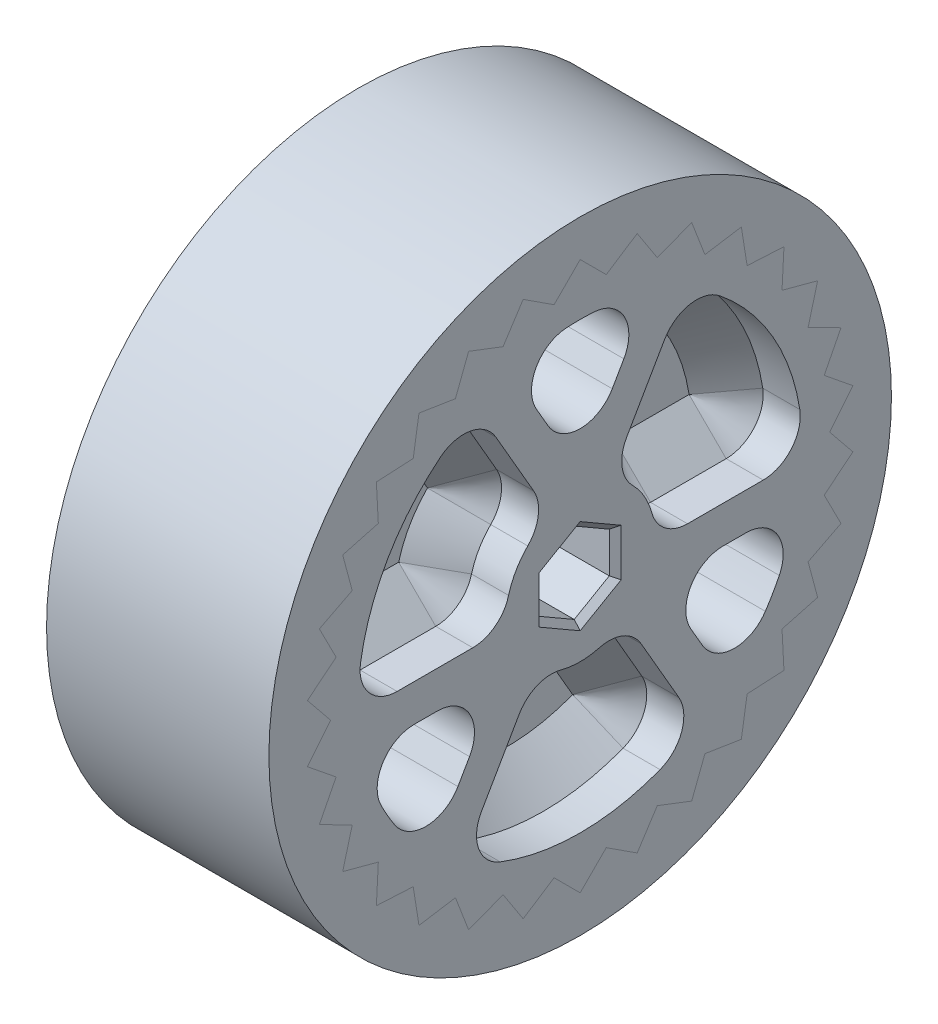
from build123d import *
from build123d.topology import SkipClean

# Parameters (mm, degrees)
SKETCH1_R               = 25.4
BOSS_EXTRUDE2_DEPTH     = 3.175
SKETCH3_R               = 6.35
BOSS_EXTRUDE3_DEPTH     = 9.525
BOSS_EXTRUDE4_REACH     = 42.66
CIRPATTERN5_COUNT       = 3
FILLET1_R               = 3.175
FILLET2_R               = 3.175
CUT_EXTRUDE2_DEPTH      = 41.65983890769865
CUT_EXTRUDE2_DEPTH_BACK = 41.65983890769865
CHAMFER1_SIZE           = 3.175
SHAFTCHAMFER_SIZE       = 0.508
SKETCH8_R               = 26.669999999999998
SKETCH8_R_2             = 12.7
BOSS_EXTRUDE5_DEPTH     = 19.05
CUT_EXTRUDE3_DEPTH      = 43.25494413450336
CIRPATTERN9_COUNT       = 30
CUT_EXTRUDE4_DEPTH      = 43.25494408941988
CUT_EXTRUDE4_DEPTH_BACK = 43.25494408941988
SKETCH10_R              = 26.669999999999998


# Some blends are built 0.0001 mm under size
with BuildPart() as part:
    # Sketch1 → Boss-Extrude2 (new, symmetric)
    with BuildSketch(Plane(origin=(0, 0, 0), x_dir=(0, 0, -1), z_dir=(1, 0, 0))):
        Circle(SKETCH1_R)
    extrude(amount=BOSS_EXTRUDE2_DEPTH, both=True)

    # Sketch3 → Boss-Extrude3 (add, symmetric)
    with BuildSketch(Plane(origin=(0, 0, 0), x_dir=(0, 0, -1), z_dir=(1, 0, 0))):
        Circle(SKETCH3_R)
    extrude(amount=BOSS_EXTRUDE3_DEPTH, both=True)

    # Boss-Extrude4: up to this face of the body (flat: up to its plane)
    boss_extrude4_end = Plane(part.part.faces().sort_by_distance((-9.525, 0, 0))[0])
    # Sketch5 → Boss-Extrude4 (add, up to the picked face)
    with BuildSketch(Plane(origin=(9.525, 0, 0), x_dir=(0, 0, -1), z_dir=(1, 0, 0)), mode=Mode.PRIVATE) as boss_extrude4_sk1:
        with BuildLine():
            Line((-2.54, 5.819871132593916), (-8.903299782514784, 16.84142965970147))
            ThreePointArc((-8.903299782514784, 16.84142965970147), (-14.505014042261495, 12.349375192040972), (-18.045993050535788, 6.102838259368668))
            Line((-18.045993050535788, 6.102838259368668), (-23.94116621038132, 8.484135812614952))
            ThreePointArc((-23.94116621038132, 8.484135812614952), (-19.29769987032471, 16.515410370767952), (-12.079956061561274, 22.343559733192674))
            ThreePointArc((-12.079956061561274, 22.343559733192674), (1.56e-15, 25.400000000000002), (12.079956061561273, 22.343559733192674))
            ThreePointArc((12.079956061561273, 22.343559733192674), (19.227340571827934, 16.59727009284778), (23.868192567962097, 8.687311640471918))
            Line((23.868192567962097, 8.687311640471918), (17.901144425971573, 6.51548373035394))
            ThreePointArc((17.901144425971573, 6.51548373035394), (14.362306470947372, 12.515057044799413), (8.903299782514784, 16.84142965970147))
            Line((8.903299782514784, 16.84142965970147), (2.54, 5.819871132593916))
            Line((2.54, 5.819871132593916), (-2.54, 5.819871132593916))
        make_face()
        with BuildLine():
            Line((-5.960089873328659, 18.09364055965093), (0, 7.770462081368971))
            Line((0, 7.770462081368971), (5.960089873328663, 18.093640559650932))
            ThreePointArc((5.960089873328663, 18.093640559650932), (1.17e-15, 19.050000000000004), (-5.960089873328659, 18.09364055965093))
        make_face(mode=Mode.SUBTRACT)
    boss_extrude4_tool1 = split(extrude(boss_extrude4_sk1.sketch, amount=-BOSS_EXTRUDE4_REACH, mode=Mode.PRIVATE), bisect_by=boss_extrude4_end, keep=Keep.BOTH, mode=Mode.PRIVATE)
    boss_extrude4 = boss_extrude4_tool1.solids().sort_by(Axis((9.525, 11.588968, -5.274231), (-1, 0, 0)))[0]
    add(boss_extrude4)

    # CirPattern5: Boss-Extrude4 ×3 about axis
    with SkipClean():  # the faces are left unmerged after this step: merging them gives an invalid solid
        cirpattern5_axis = Axis((0, -4e-17, 2e-17), (1, 0, 0))
        for i in range(1, CIRPATTERN5_COUNT):
            add(boss_extrude4.rotate(cirpattern5_axis, i * 360 / CIRPATTERN5_COUNT))

    # Fillet1
    # the kernel refuses this fillet: 3.175 mm, written as the material it adds along each edge
    with BuildSketch(Plane(origin=(9.525, -0.7102310406844579, 19.036755812607577), x_dir=(0, -2.38e-15, -1), z_dir=(-1, 0, 0))) as fillet1_piece_1_section:
        with BuildLine():
            CenterArc((3.3542643339810048, -3.175), FILLET1_R, 89.99999999999996, 98.93193584049112)
            ThreePointArc((0.21776603825569132, -3.6679537918630993), (0.02024089159850024, -1.8392395698991024), (0, 0))
            Line((0, 0), (3.354264333981007, 0))
        make_face()
    fillet1_piece_1 = extrude(amount=15.536031197782203, mode=Mode.PRIVATE)
    fillet1_piece_1 = split(fillet1_piece_1, bisect_by=Plane(origin=(-3.175, 0.11590119429228372, 18.292392376393625), z_dir=(1, 0, 0)), keep=Keep.TOP, mode=Mode.PRIVATE)
    add(fillet1_piece_1)
    with BuildSketch(Plane(origin=(9.525, -0.7102310406844823, 6.310156247578044), x_dir=(0, 1.38e-15, 1), z_dir=(-1, 0, 0))) as fillet1_piece_2_section:
        with BuildLine():
            CenterArc((2.8904165050931043, 3.175), FILLET1_R, 194.99699559216134, 75.00300440783866)
            ThreePointArc((-0.17644107913061133, 2.35341034689483), (0.02207235062195231, 1.1849741081832343), (0, 0))
            Line((0, 0), (2.890416505093105, 0))
        make_face()
    fillet1_piece_2 = extrude(amount=13.576041262732764, mode=Mode.PRIVATE)
    fillet1_piece_2 = split(fillet1_piece_2, bisect_by=Plane(origin=(-3.175, -0.1820541246361337, 6.989140739238721), z_dir=(1, 0, 0)), keep=Keep.TOP, mode=Mode.PRIVATE)
    add(fillet1_piece_2)
    with BuildSketch(Plane(origin=(9.525, -5.109640091909432, 3.7701562475780452), x_dir=(0, -0.43385429013787896, -0.900983049190692), z_dir=(-1, 0, 0))) as fillet1_piece_3_section:
        with BuildLine():
            CenterArc((2.950018992331989, 3.1196987863887142), FILLET1_R, 184.2875870351815, 75.00300440783866)
            Line((-0.21609530676800845, 2.8823272526393455), (0, 0))
            ThreePointArc((0, 0), (1.1800075969327894, 0.11060242722256897), (2.3600151938655904, -5e-17))
        make_face()
    fillet1_piece_3 = extrude(amount=13.576041262732764, mode=Mode.PRIVATE)
    fillet1_piece_3 = split(fillet1_piece_3, bisect_by=Plane(origin=(-3.175, -5.961746368487418, 3.652233866417988), z_dir=(1, 0, 0)), keep=Keep.TOP, mode=Mode.PRIVATE)
    add(fillet1_piece_3)
    with BuildSketch(Plane(origin=(9.525, -16.131198619017, 10.133456030092796), x_dir=(0, -0.447795663680597, -0.8941359200864563), z_dir=(-1, 0, 0))) as fillet1_piece_4_section:
        with BuildLine():
            CenterArc((3.368211439186808, -3.1602002979476134), FILLET1_R, 84.46572042198898, 98.93193584049106)
            Line((0.1987922856852959, -3.3483683861500437), (0, 0))
            ThreePointArc((0, 0), (1.837206239556442, 0.08879821231431297), (3.6744124791128843, -5e-17))
        make_face()
    fillet1_piece_4 = extrude(amount=15.536031197782211, mode=Mode.PRIVATE)
    fillet1_piece_4 = split(fillet1_piece_4, bisect_by=Plane(origin=(-3.175, -15.899627091095816, 9.045822809610737), z_dir=(1, 0, 0)), keep=Keep.TOP, mode=Mode.PRIVATE)
    add(fillet1_piece_4)
    with BuildSketch(Plane(origin=(9.525, -3.885231040684464, 18.64959730826653), x_dir=(0, -0.9450213382412374, -0.3270086700207519), z_dir=(-1, 0, 0))) as fillet1_piece_5_section:
        with BuildLine():
            CenterArc((4.449415253717177, -3.1491286068759607), FILLET1_R, 82.68067523582678, 116.40663891770015)
            Line((1.4489725048012276, -4.187381134191788), (0, 0))
            ThreePointArc((0, 0), (2.4269537747548258, 0.1552283587442323), (4.8539075495096515, 2.1e-16))
        make_face()
    fillet1_piece_5 = extrude(amount=18.48476887377413, mode=Mode.PRIVATE)
    fillet1_piece_5 = split(fillet1_piece_5, bisect_by=Plane(origin=(-3.175, -4.983509998192897, 17.329741100134743), z_dir=(1, 0, 0)), keep=Keep.TOP, mode=Mode.PRIVATE)
    add(fillet1_piece_5)
    with BuildSketch(Plane(origin=(9.525, -14.208409518966457, 12.689507434937868), x_dir=(0, 0.8660254037844392, -0.4999999999999991), z_dir=(-1, 0, 0))) as fillet1_piece_6_section:
        with BuildLine():
            CenterArc((4.43099109485172, -3.1750000000000007), FILLET1_R, 89.99999999999999, 116.4066389177014)
            ThreePointArc((1.5872698521687754, -4.587046208136892), (0.6469408147709594, -2.34428412321089), (0, 0))
            Line((0, 0), (4.430991094851721, -3e-17))
        make_face()
    fillet1_piece_6 = extrude(amount=18.48476887377416, mode=Mode.PRIVATE)
    fillet1_piece_6 = split(fillet1_piece_6, bisect_by=Plane(origin=(-3.175, -12.51624103462754, 12.98071680851615), z_dir=(1, 0, 0)), keep=Keep.TOP, mode=Mode.PRIVATE)
    add(fillet1_piece_6)
    with BuildSketch(Plane(origin=(9.525, -3.885231040684484, 6.7294175616092335), x_dir=(0, -0.8660254037844392, 0.4999999999999991), z_dir=(-1, 0, 0))) as fillet1_piece_7_section:
        with BuildLine():
            CenterArc((FILLET1_R * 1.73205080757, FILLET1_R), FILLET1_R, 150.00000000000023, 119.99999999999972)
            Line((FILLET1_R * 0.866025403784, FILLET1_R * 1.5), (0, 0))
            Line((0, 0), (FILLET1_R * 1.73205080757, 9e-17))
        make_face()
    fillet1_piece_7 = extrude(amount=20.098153285077924, mode=Mode.PRIVATE)
    fillet1_piece_7 = split(fillet1_piece_7, bisect_by=Plane(origin=(-3.175, -5.052771317428874, 8.751656640813545), z_dir=(1, 0, 0)), keep=Keep.TOP, mode=Mode.PRIVATE)
    add(fillet1_piece_7)
    with BuildSketch(Plane(origin=(9.525, -16.131198619017013, -10.133456030092784), x_dir=(0, -0.44779566368059587, 0.8941359200864568), z_dir=(-1, 0, 0))) as fillet1_piece_8_section:
        with BuildLine():
            CenterArc((3.3682114391868097, 3.1602002979476143), FILLET1_R, 176.60234373751985, 98.93193584049118)
            Line((0.19879228568529747, 3.348368386150048), (0, 0))
            ThreePointArc((0, 0), (1.8372062395564435, -0.0887982123143144), (3.674412479112885, -1.9e-16))
        make_face()
    fillet1_piece_8 = extrude(amount=15.536031197782213, mode=Mode.PRIVATE)
    fillet1_piece_8 = split(fillet1_piece_8, bisect_by=Plane(origin=(-3.175, -15.899627091095827, -9.045822809610733), z_dir=(1, 0, 0)), keep=Keep.TOP, mode=Mode.PRIVATE)
    add(fillet1_piece_8)
    with BuildSketch(Plane(origin=(9.525, -5.1096400919094345, -3.7701562475780417), x_dir=(0, -0.8660254037844396, -0.4999999999999982), z_dir=(-1, 0, 0))) as fillet1_piece_9_section:
        with BuildLine():
            CenterArc((2.8904165050931026, 3.175), FILLET1_R, 194.9969955921613, 75.00300440783872)
            ThreePointArc((-0.17644107913061302, 2.3534103468948313), (0.02207235062195104, 1.184974108183239), (0, 0))
            Line((0, 0), (2.8904165050931026, -1e-17))
        make_face()
    fillet1_piece_9 = extrude(amount=13.576041262732758, mode=Mode.PRIVATE)
    fillet1_piece_9 = split(fillet1_piece_9, bisect_by=Plane(origin=(-3.175, -5.961746368487417, -3.6522338664179856), z_dir=(1, 0, 0)), keep=Keep.TOP, mode=Mode.PRIVATE)
    add(fillet1_piece_9)
    with BuildSketch(Plane(origin=(9.525, -0.7102310406844873, -6.310156247578044), x_dir=(0, 1.11e-15, -1), z_dir=(-1, 0, 0))) as fillet1_piece_10_section:
        with BuildLine():
            CenterArc((2.8904165050931034, -3.175), FILLET1_R, 90, 75.00300440783866)
            ThreePointArc((-0.17644107913061285, -2.353410346894831), (0.02207235062195199, -1.1849741081832343), (0, 0))
            Line((0, 0), (2.8904165050931034, 0))
        make_face()
    fillet1_piece_10 = extrude(amount=13.57604126273276, mode=Mode.PRIVATE)
    fillet1_piece_10 = split(fillet1_piece_10, bisect_by=Plane(origin=(-3.175, -0.18205412463613493, -6.989140739238719), z_dir=(1, 0, 0)), keep=Keep.TOP, mode=Mode.PRIVATE)
    add(fillet1_piece_10)
    with BuildSketch(Plane(origin=(9.525, -0.7102310406844748, -19.036755812607574), x_dir=(0, 0.9982422530713423, 0.05926553959131868), z_dir=(-1, 0, 0))) as fillet1_piece_11_section:
        with BuildLine():
            CenterArc((3.3682114391868097, -3.1602002979476143), FILLET1_R, 84.46572042198902, 98.93193584049106)
            Line((0.1987922856852979, -3.348368386150046), (0, 0))
            ThreePointArc((0, 0), (1.8372062395564421, 0.08879821231431476), (3.6744124791128843, -1e-17))
        make_face()
    fillet1_piece_11 = extrude(amount=15.536031197782211, mode=Mode.PRIVATE)
    fillet1_piece_11 = split(fillet1_piece_11, bisect_by=Plane(origin=(-3.175, 0.11590119429227418, -18.29239237639363), z_dir=(1, 0, 0)), keep=Keep.TOP, mode=Mode.PRIVATE)
    add(fillet1_piece_11)
    with BuildSketch(Plane(origin=(9.525, -14.208409518966477, -12.689507434937859), x_dir=(0, 0.7557084846163529, -0.6549081510249016), z_dir=(-1, 0, 0))) as fillet1_piece_12_section:
        with BuildLine():
            CenterArc((4.4494152537171825, -3.1491286068759607), FILLET1_R, 82.68067523582683, 116.40663891770015)
            Line((1.448972504801235, -4.187381134191791), (0, 0))
            ThreePointArc((0, 0), (2.426953774754827, 0.15522835874423127), (4.853907549509655, 3e-17))
        make_face()
    fillet1_piece_12 = extrude(amount=18.48476887377414, mode=Mode.PRIVATE)
    fillet1_piece_12 = split(fillet1_piece_12, bisect_by=Plane(origin=(-3.175, -12.516241034627523, -12.980716808516158), z_dir=(1, 0, 0)), keep=Keep.TOP, mode=Mode.PRIVATE)
    add(fillet1_piece_12)
    with BuildSketch(Plane(origin=(9.525, -3.8852310406844826, -18.64959730826652), x_dir=(0, -2e-16, 1), z_dir=(-1, 0, 0))) as fillet1_piece_13_section:
        with BuildLine():
            CenterArc((4.430991094851707, -3.175), FILLET1_R, 89.99999999999994, 116.4066389177014)
            ThreePointArc((1.5872698521687605, -4.587046208136888), (0.6469408147709577, -2.344284123210884), (0, 0))
            Line((0, 0), (4.430991094851709, 0))
        make_face()
    fillet1_piece_13 = extrude(amount=18.484768873774144, mode=Mode.PRIVATE)
    fillet1_piece_13 = split(fillet1_piece_13, bisect_by=Plane(origin=(-3.175, -4.983509998192876, -17.32974110013475), z_dir=(1, 0, 0)), keep=Keep.TOP, mode=Mode.PRIVATE)
    add(fillet1_piece_13)
    with BuildSketch(Plane(origin=(9.525, -3.885231040684489, -6.729417561609231), x_dir=(0, 7.3e-16, -1), z_dir=(-1, 0, 0))) as fillet1_piece_14_section:
        with BuildLine():
            CenterArc((FILLET1_R * 1.73205080757, FILLET1_R), FILLET1_R, 150.00000000000017, 119.9999999999998)
            Line((FILLET1_R * 0.866025403784, FILLET1_R * 1.5), (0, 0))
            Line((0, 0), (FILLET1_R * 1.73205080757, 0))
        make_face()
    fillet1_piece_14 = extrude(amount=20.09815328507792, mode=Mode.PRIVATE)
    fillet1_piece_14 = split(fillet1_piece_14, bisect_by=Plane(origin=(-3.175, -5.05277131742888, -8.75165664081354), z_dir=(1, 0, 0)), keep=Keep.TOP, mode=Mode.PRIVATE)
    add(fillet1_piece_14)
    with BuildSketch(Plane(origin=(9.525, 16.84142965970147, -8.903299782514786), x_dir=(0, -0.8660254037844375, 0.500000000000002), z_dir=(-1, 0, 0))) as fillet1_piece_15_section:
        with BuildLine():
            CenterArc((3.3542643339810083, -3.1749999999999994), FILLET1_R, 89.99999999999994, 98.93193584049118)
            ThreePointArc((0.21776603825569638, -3.667953791863103), (0.02024089159850134, -1.8392395698991046), (0, 0))
            Line((0, 0), (3.3542643339810114, 2e-16))
        make_face()
    fillet1_piece_15 = extrude(amount=15.536031197782213, mode=Mode.PRIVATE)
    fillet1_piece_15 = split(fillet1_piece_15, bisect_by=Plane(origin=(-3.175, 15.783725896803535, -9.24656956678288), z_dir=(1, 0, 0)), keep=Keep.TOP, mode=Mode.PRIVATE)
    add(fillet1_piece_15)
    with BuildSketch(Plane(origin=(9.525, 5.819871132593916, -2.54), x_dir=(0, 0.8660254037844379, -0.500000000000001), z_dir=(-1, 0, 0))) as fillet1_piece_16_section:
        with BuildLine():
            CenterArc((2.890416505093105, 3.1749999999999994), FILLET1_R, 194.99699559216134, 75.00300440783872)
            ThreePointArc((-0.1764410791306104, 2.3534103468948304), (0.02207235062195155, 1.1849741081832337), (0, 0))
            Line((0, 0), (2.890416505093107, 1e-17))
        make_face()
    fillet1_piece_16 = extrude(amount=13.576041262732769, mode=Mode.PRIVATE)
    fillet1_piece_16 = split(fillet1_piece_16, bisect_by=Plane(origin=(-3.175, 6.143800493123549, -3.3369068728207316), z_dir=(1, 0, 0)), keep=Keep.TOP, mode=Mode.PRIVATE)
    add(fillet1_piece_16)
    with BuildSketch(Plane(origin=(9.525, 5.819871132593916, 2.54), x_dir=(0, 0.8660254037844377, 0.5000000000000016), z_dir=(-1, 0, 0))) as fillet1_piece_17_section:
        with BuildLine():
            CenterArc((2.890416505093104, -3.175), FILLET1_R, 90, 75.00300440783869)
            ThreePointArc((-0.17644107913061133, -2.353410346894832), (0.02207235062195223, -1.184974108183234), (0, 0))
            Line((0, 0), (2.8904165050931043, 9e-17))
        make_face()
    fillet1_piece_17 = extrude(amount=13.57604126273276, mode=Mode.PRIVATE)
    fillet1_piece_17 = split(fillet1_piece_17, bisect_by=Plane(origin=(-3.175, 6.143800493123548, 3.336906872820731), z_dir=(1, 0, 0)), keep=Keep.TOP, mode=Mode.PRIVATE)
    add(fillet1_piece_17)
    with BuildSketch(Plane(origin=(9.525, 16.84142965970147, 8.903299782514782), x_dir=(0, -0.5504465893907462, 0.8348703804951373), z_dir=(-1, 0, 0))) as fillet1_piece_18_section:
        with BuildLine():
            CenterArc((3.368211439186808, -3.1602002979476147), FILLET1_R, 84.46572042198903, 98.93193584049112)
            Line((0.19879228568529586, -3.3483683861500495), (0, 0))
            ThreePointArc((0, 0), (1.8372062395564426, 0.08879821231431313), (3.6744124791128816, -1e-17))
        make_face()
    fillet1_piece_18 = extrude(amount=15.536031197782204, mode=Mode.PRIVATE)
    fillet1_piece_18 = split(fillet1_piece_18, bisect_by=Plane(origin=(-3.175, 15.783725896803537, 9.246569566782886), z_dir=(1, 0, 0)), keep=Keep.TOP, mode=Mode.PRIVATE)
    add(fillet1_piece_18)
    with BuildSketch(Plane(origin=(9.525, 18.093640559650936, -5.9600898733286645), x_dir=(0, 0.18931285362488398, 0.9819168210456541), z_dir=(-1, 0, 0))) as fillet1_piece_19_section:
        with BuildLine():
            CenterArc((4.449415253717183, -3.149128606875961), FILLET1_R, 82.6806752358268, 116.4066389177002)
            Line((1.4489725048012343, -4.18738113419179), (0, 0))
            ThreePointArc((0, 0), (2.4269537747548284, 0.1552283587442305), (4.853907549509657, 3e-17))
        make_face()
    fillet1_piece_19 = extrude(amount=18.484768873774144, mode=Mode.PRIVATE)
    fillet1_piece_19 = split(fillet1_piece_19, bisect_by=Plane(origin=(-3.175, 17.499751032820416, -4.349024291618576), z_dir=(1, 0, 0)), keep=Keep.TOP, mode=Mode.PRIVATE)
    add(fillet1_piece_19)
    with BuildSketch(Plane(origin=(9.525, 18.093640559650932, 5.960089873328657), x_dir=(0, -0.8660254037844383, -0.5000000000000006), z_dir=(-1, 0, 0))) as fillet1_piece_20_section:
        with BuildLine():
            CenterArc((4.430991094851704, -3.1749999999999994), FILLET1_R, 89.99999999999997, 116.40663891770134)
            ThreePointArc((1.5872698521687594, -4.5870462081368855), (0.6469408147709614, -2.34428412321088), (0, 0))
            Line((0, 0), (4.430991094851706, 3.2e-16))
        make_face()
    fillet1_piece_20 = extrude(amount=18.484768873774133, mode=Mode.PRIVATE)
    fillet1_piece_20 = split(fillet1_piece_20, bisect_by=Plane(origin=(-3.175, 17.49975103282041, 4.349024291618612), z_dir=(1, 0, 0)), keep=Keep.TOP, mode=Mode.PRIVATE)
    add(fillet1_piece_20)
    with BuildSketch(Plane(origin=(9.525, 7.770462081368971, 0), x_dir=(0, 0.8660254037844378, 0.5000000000000013), z_dir=(-1, 0, 0))) as fillet1_piece_21_section:
        with BuildLine():
            CenterArc((FILLET1_R * 1.73205080757, FILLET1_R), FILLET1_R, 150.0000000000002, 119.9999999999998)
            Line((FILLET1_R * 0.866025403784, FILLET1_R * 1.5), (0, 0))
            Line((0, 0), (FILLET1_R * 1.73205080757, 1.1e-16))
        make_face()
    fillet1_piece_21 = extrude(amount=20.098153285077917, mode=Mode.PRIVATE)
    fillet1_piece_21 = split(fillet1_piece_21, bisect_by=Plane(origin=(-3.175, 10.10554263485775, -1.6e-16), z_dir=(1, 0, 0)), keep=Keep.TOP, mode=Mode.PRIVATE)
    add(fillet1_piece_21)

    # Fillet2
    # the kernel refuses this fillet: 3.175 mm, written as the material it adds along each edge
    with BuildSketch(Plane(origin=(6.011031197782204, -16.131198619017002, 10.133456030092798), x_dir=(0, -0.44779566368059637, -0.8941359200864566), z_dir=(-1, 0, 0))) as fillet2_piece_1:
        with BuildLine():
            CenterArc((3.368211439186808, -3.1602002979476143), FILLET2_R, 84.46572042198905, 98.93193584049112)
            Line((0.19879228568529578, -3.3483683861500486), (0, 0))
            ThreePointArc((0, 0), (1.8372062395564404, 0.08879821231431508), (3.674412479112881, 9e-17))
        make_face()
    extrude(amount=15.536031197782204)
    with BuildSketch(Plane(origin=(8.959768873774157, -3.8852310406844617, 18.649597308266532), x_dir=(0, -1.9e-15, -1), z_dir=(-1, 0, 0))) as fillet2_piece_2:
        with BuildLine():
            CenterArc((4.430991094851721, 3.175), FILLET2_R, 153.5933610822986, 116.40663891770137)
            ThreePointArc((1.5872698521687754, 4.587046208136891), (0.6469408147709617, 2.344284123210886), (0, 0))
            Line((0, 0), (4.43099109485172, 0))
        make_face()
    extrude(amount=18.484768873774158)
    with BuildSketch(Plane(origin=(8.959768873774177, -14.208409518966459, 12.689507434937868), x_dir=(0, 0.8660254037844392, -0.4999999999999993), z_dir=(-1, 0, 0))) as fillet2_piece_3:
        with BuildLine():
            CenterArc((4.430991094851723, -3.1749999999999994), FILLET2_R, 89.99999999999999, 116.40663891770157)
            ThreePointArc((1.5872698521687831, -4.587046208136899), (0.6469408147709629, -2.3442841232108944), (0, 0))
            Line((0, 0), (4.4309910948517235, -5e-17))
        make_face()
    extrude(amount=18.48476887377418)
    with BuildSketch(Plane(origin=(10.573153285077918, -3.8852310406844843, 6.729417561609234), x_dir=(0, 1.78e-15, 1), z_dir=(-1, 0, 0))) as fillet2_piece_4_section:
        with BuildLine():
            CenterArc((FILLET2_R * 1.73205080757, -FILLET2_R), FILLET2_R, 90, 119.99999999999977)
            Line((FILLET2_R * 0.866025403784, -FILLET2_R * 1.5), (0, 0))
            Line((0, 0), (FILLET2_R * 1.73205080757, 0))
        make_face()
    fillet2_piece_4 = extrude(amount=20.09815328507792, mode=Mode.PRIVATE)
    fillet2_piece_4 = split(fillet2_piece_4, bisect_by=Plane(origin=(9.525, -5.053065694261843, 8.752166516444822), z_dir=(-1, 0, 0)), keep=Keep.TOP, mode=Mode.PRIVATE)
    add(fillet2_piece_4)
    with BuildSketch(Plane(origin=(8.95976887377417, -14.208409518966477, -12.689507434937857), x_dir=(0, 0.8660254037844397, 0.4999999999999981), z_dir=(-1, 0, 0))) as fillet2_piece_5:
        with BuildLine():
            CenterArc((4.430991094851724, 3.1750000000000007), FILLET2_R, 153.59336108229851, 116.40663891770151)
            ThreePointArc((1.5872698521687825, 4.587046208136897), (0.6469408147709644, 2.344284123210892), (0, 0))
            Line((0, 0), (4.430991094851725, -1.1e-16))
        make_face()
    extrude(amount=18.48476887377417)
    with BuildSketch(Plane(origin=(8.959768873774143, -3.885231040684479, -18.649597308266525), x_dir=(0, -1e-15, 1), z_dir=(-1, 0, 0))) as fillet2_piece_6:
        with BuildLine():
            CenterArc((4.430991094851718, -3.175), FILLET2_R, 90, 116.40663891770146)
            ThreePointArc((1.587269852168775, -4.5870462081368935), (0.6469408147709631, -2.3442841232108873), (0, 0))
            Line((0, 0), (4.430991094851718, 0))
        make_face()
    extrude(amount=18.484768873774144)
    with BuildSketch(Plane(origin=(10.573153285077918, -3.8852310406844897, -6.729417561609231), x_dir=(0, -0.8660254037844398, -0.49999999999999817), z_dir=(-1, 0, 0))) as fillet2_piece_7_section:
        with BuildLine():
            CenterArc((FILLET2_R * 1.73205080757, -FILLET2_R), FILLET2_R, 90.00000000000003, 119.99999999999977)
            Line((FILLET2_R * 0.866025403784, -FILLET2_R * 1.5), (0, 0))
            Line((0, 0), (FILLET2_R * 1.73205080757, -9e-17))
        make_face()
    fillet2_piece_7 = extrude(amount=20.09815328507792, mode=Mode.PRIVATE)
    fillet2_piece_7 = split(fillet2_piece_7, bisect_by=Plane(origin=(9.525, -5.053065694261852, -8.752166516444817), z_dir=(-1, 0, 0)), keep=Keep.TOP, mode=Mode.PRIVATE)
    add(fillet2_piece_7)
    with BuildSketch(Plane(origin=(6.011031197782204, -0.7102310406844587, 19.036755812607577), x_dir=(0, -1.99e-15, -1), z_dir=(-1, 0, 0))) as fillet2_piece_8:
        with BuildLine():
            CenterArc((3.354264333981008, -3.175), FILLET2_R, 89.99999999999999, 98.93193584049112)
            ThreePointArc((0.21776603825569635, -3.6679537918631), (0.02024089159850096, -1.8392395698991015), (0, 0))
            Line((0, 0), (3.3542643339810088, 0))
        make_face()
    extrude(amount=15.536031197782204)
    with BuildSketch(Plane(origin=(4.0510412627327606, -0.7102310406844835, 6.310156247578044), x_dir=(0, 1.96e-15, 1), z_dir=(-1, 0, 0))) as fillet2_piece_9:
        with BuildLine():
            CenterArc((2.890416505093106, 3.175), FILLET2_R, 194.9969955921613, 75.00300440783866)
            ThreePointArc((-0.17644107913060997, 2.3534103468948313), (0.022072350621953, 1.1849741081832357), (0, 0))
            Line((0, 0), (2.890416505093105, 0))
        make_face()
    extrude(amount=13.576041262732762)
    with BuildSketch(Plane(origin=(4.05104126273276, -5.109640091909432, 3.770156247578046), x_dir=(0, -0.8660254037844395, 0.49999999999999845), z_dir=(-1, 0, 0))) as fillet2_piece_10:
        with BuildLine():
            CenterArc((2.890416505093105, -3.1749999999999994), FILLET2_R, 90.00000000000004, 75.00300440783862)
            ThreePointArc((-0.17644107913061027, -2.353410346894829), (0.02207235062195225, -1.184974108183231), (0, 0))
            Line((0, 0), (2.890416505093103, 1.7e-16))
        make_face()
    extrude(amount=13.57604126273276)
    with BuildSketch(Plane(origin=(6.011031197782211, -16.131198619017013, -10.133456030092786), x_dir=(0, 0.8660254037844398, 0.49999999999999795), z_dir=(-1, 0, 0))) as fillet2_piece_11:
        with BuildLine():
            CenterArc((3.354264333981011, -3.1750000000000007), FILLET2_R, 90.00000000000003, 98.93193584049112)
            ThreePointArc((0.21776603825569932, -3.6679537918631038), (0.02024089159850199, -1.8392395698991029), (0, 0))
            Line((0, 0), (3.35426433398101, -2e-17))
        make_face()
    extrude(amount=15.536031197782211)
    with BuildSketch(Plane(origin=(4.051041262732758, -5.109640091909434, -3.7701562475780426), x_dir=(0, -0.8660254037844398, -0.49999999999999784), z_dir=(-1, 0, 0))) as fillet2_piece_12:
        with BuildLine():
            CenterArc((2.8904165050931043, 3.1749999999999994), FILLET2_R, 194.99699559216128, 75.00300440783872)
            ThreePointArc((-0.17644107913061163, 2.3534103468948326), (0.02207235062195276, 1.184974108183235), (0, 0))
            Line((0, 0), (2.890416505093103, 0))
        make_face()
    extrude(amount=13.576041262732758)
    with BuildSketch(Plane(origin=(4.05104126273276, -0.7102310406844873, -6.310156247578044), x_dir=(0, 1.11e-15, -1), z_dir=(-1, 0, 0))) as fillet2_piece_13:
        with BuildLine():
            CenterArc((2.8904165050931034, -3.175), FILLET2_R, 90, 75.00300440783866)
            ThreePointArc((-0.17644107913061285, -2.353410346894831), (0.02207235062195199, -1.1849741081832343), (0, 0))
            Line((0, 0), (2.8904165050931034, 0))
        make_face()
    extrude(amount=13.57604126273276)
    with BuildSketch(Plane(origin=(6.011031197782211, -0.7102310406844724, -19.036755812607574), x_dir=(0, 0.9982422530713423, 0.059265539591318715), z_dir=(-1, 0, 0))) as fillet2_piece_14:
        with BuildLine():
            CenterArc((3.3682114391868074, -3.1602002979476143), FILLET2_R, 84.46572042198902, 98.93193584049106)
            Line((0.19879228568529558, -3.348368386150046), (0, 0))
            ThreePointArc((0, 0), (1.8372062395564404, 0.08879821231431471), (3.674412479112882, -1e-17))
        make_face()
    extrude(amount=15.536031197782211)
    with BuildSketch(Plane(origin=(6.011031197782206, 16.84142965970147, 8.903299782514782), x_dir=(0, -0.5504465893907462, 0.8348703804951373), z_dir=(-1, 0, 0))) as fillet2_piece_15:
        with BuildLine():
            CenterArc((3.368211439186808, -3.1602002979476147), FILLET2_R, 84.46572042198903, 98.93193584049112)
            Line((0.19879228568529586, -3.3483683861500495), (0, 0))
            ThreePointArc((0, 0), (1.8372062395564426, 0.08879821231431313), (3.6744124791128816, -1e-17))
        make_face()
    extrude(amount=15.536031197782206)
    with BuildSketch(Plane(origin=(8.959768873774166, 18.093640559650936, -5.960089873328665), x_dir=(0, -0.8660254037844379, 0.5000000000000014), z_dir=(-1, 0, 0))) as fillet2_piece_16:
        with BuildLine():
            CenterArc((4.430991094851723, 3.1750000000000003), FILLET2_R, 153.59336108229857, 116.4066389177014)
            ThreePointArc((1.5872698521687771, 4.5870462081368935), (0.6469408147709651, 2.3442841232108895), (0, 0))
            Line((0, 0), (4.430991094851722, -1.1e-16))
        make_face()
    extrude(amount=18.48476887377417)
    with BuildSketch(Plane(origin=(8.959768873774138, 18.09364055965093, 5.96008987332866), x_dir=(0, -0.8660254037844378, -0.5000000000000013), z_dir=(-1, 0, 0))) as fillet2_piece_17:
        with BuildLine():
            CenterArc((4.430991094851713, -3.174999999999999), FILLET2_R, 90, 116.4066389177014)
            ThreePointArc((1.5872698521687703, -4.587046208136888), (0.6469408147709617, -2.3442841232108838), (0, 0))
            Line((0, 0), (4.430991094851713, 2e-16))
        make_face()
    extrude(amount=18.484768873774136)
    with BuildSketch(Plane(origin=(10.573153285077918, 7.77046208136897, 3.4e-16), x_dir=(0, 0.8660254037844378, -0.5000000000000013), z_dir=(-1, 0, 0))) as fillet2_piece_18_section:
        with BuildLine():
            CenterArc((FILLET2_R * 1.73205080757, -FILLET2_R), FILLET2_R, 89.99999999999999, 119.99999999999983)
            Line((FILLET2_R * 0.866025403784, -FILLET2_R * 1.5), (0, 0))
            Line((0, 0), (FILLET2_R * 1.73205080757, 2.1e-16))
        make_face()
    fillet2_piece_18 = extrude(amount=20.09815328507792, mode=Mode.PRIVATE)
    fillet2_piece_18 = split(fillet2_piece_18, bisect_by=Plane(origin=(9.525, 10.106131388523687, 1.39e-15), z_dir=(-1, 0, 0)), keep=Keep.TOP, mode=Mode.PRIVATE)
    add(fillet2_piece_18)
    with BuildSketch(Plane(origin=(6.011031197782215, 16.84142965970147, -8.903299782514784), x_dir=(0, -0.8660254037844378, 0.5000000000000016), z_dir=(-1, 0, 0))) as fillet2_piece_19:
        with BuildLine():
            CenterArc((3.354264333981007, -3.1750000000000003), FILLET2_R, 89.99999999999999, 98.93193584049095)
            ThreePointArc((0.2177660382556944, -3.6679537918630927), (0.02024089159849894, -1.8392395698990964), (0, 0))
            Line((0, 0), (3.354264333981008, -1e-16))
        make_face()
    extrude(amount=15.536031197782215)
    with BuildSketch(Plane(origin=(4.051041262732769, 5.819871132593917, -2.539999999999999), x_dir=(0, 0.8660254037844378, -0.5000000000000013), z_dir=(-1, 0, 0))) as fillet2_piece_20:
        with BuildLine():
            CenterArc((2.890416505093106, 3.175), FILLET2_R, 194.9969955921613, 75.00300440783872)
            ThreePointArc((-0.17644107913060997, 2.3534103468948318), (0.02207235062195161, 1.184974108183235), (0, 0))
            Line((0, 0), (2.890416505093107, 1.7e-16))
        make_face()
    extrude(amount=13.576041262732769)
    with BuildSketch(Plane(origin=(4.0510412627327606, 5.819871132593916, 2.54), x_dir=(0, 0.8660254037844377, 0.5000000000000016), z_dir=(-1, 0, 0))) as fillet2_piece_21:
        with BuildLine():
            CenterArc((2.890416505093104, -3.175), FILLET2_R, 90, 75.00300440783869)
            ThreePointArc((-0.17644107913061133, -2.353410346894832), (0.02207235062195223, -1.184974108183234), (0, 0))
            Line((0, 0), (2.8904165050931043, 9e-17))
        make_face()
    extrude(amount=13.576041262732762)

    # Sketch6 → Cut-Extrude2 (cut, two sides: drawn at the far end of the back side and taken through both)
    with BuildSketch(Plane(origin=(9.525, 0, 0), x_dir=(0, 0, -1), z_dir=(1, 0, 0)).offset(-CUT_EXTRUDE2_DEPTH_BACK)):
        Polygon((0, 3.4641016151377566), (-3.0000000000000004, 1.7320508075688774), (-3.0000000000000004, -1.7320508075688774), (-8.4e-16, -3.4641016151377557), (2.9999999999999996, -1.7320508075688774), (3, 1.7320508075688787), align=None)
    extrude(amount=CUT_EXTRUDE2_DEPTH + CUT_EXTRUDE2_DEPTH_BACK, mode=Mode.SUBTRACT)

    # Chamfer1
    chamfer1_edges = [part.edges().sort_by_distance(p)[0] for p in [
        (3.175, 3.175000000000129, 5.499261314031111),
        (3.175, -0.7102310406844721, 12.441532115649),
        (3.175, 11.129798394493887, 5.605687934035292),
        (3.175, 9.525000000000139, 16.49778394209348),
        (3.175, -0.7102310406844801, -12.441532115648915),
        (3.175, 3.1750000000001286, -5.49926131403111),
        (3.175, 9.525000000000261, -16.49778394209341),
        (3.175, 11.129798394493962, -5.605687934035334),
        (3.175, -6.35, -8.907e-14),
        (3.175, -10.419567353809384, -6.835844181613297),
        (3.175, -10.419567353809407, 6.835844181613319),
        (3.175, -19.05, 5.171e-14),
        (-3.1749999999999994, -0.7102310406844801, -12.441532115648915),
        (-3.175, 3.175000000000191, -5.499261314031075),
        (-3.1749999999999994, 11.129798394493962, -5.605687934035334),
        (-3.174999999999999, 9.713741879836018, -16.387364604838695),
        (-3.1749999999999994, -10.419567353809407, 6.835844181613319),
        (-3.175, -6.35, -7.779e-14),
        (-3.1749999999999994, -10.419567353809384, -6.835844181613297),
        (-3.174999999999999, -19.04874498878625, -0.21866493132353762),
        (-3.1749999999999994, 11.129798394493887, 5.605687934035292),
        (-3.175, 3.175000000000192, 5.499261314031074),
        (-3.1749999999999994, -0.7102310406844721, 12.441532115649),
        (-3.174999999999999, 9.335003108950524, 16.60602953616198),
    ]]
    chamfer(chamfer1_edges, length=CHAMFER1_SIZE - 0.0001)  # a hair under: the kernel refuses the full size

    # ShaftChamfer
    shaftchamfer_edges = [part.edges().sort_by_distance(p)[0] for p in [
        (9.525, 2.598076211353316, 1.5000000000000009),
        (9.525, 0, 3),
        (9.525, -2.5980762113533187, 1.5000000000000013),
        (9.525, -2.5980762113533173, -1.4999999999999993),
        (9.525, 8.9e-16, -2.9999999999999996),
        (9.525, 2.598076211353318, -1.4999999999999998),
        (-9.525, 2.598076211353318, -1.5),
        (-9.525, 6.7e-16, -2.9999999999999996),
        (-9.525, -2.5980762113533165, -1.4999999999999996),
        (-9.525000000000002, -2.5980762113533173, 1.5000000000000009),
        (-9.525, 0, 3.0000000000000004),
        (-9.525, 2.598076211353317, 1.5000000000000004),
    ]]
    chamfer(shaftchamfer_edges, length=SHAFTCHAMFER_SIZE)

    # Sketch10 → Cut-Extrude4 (cut, two sides: drawn at the far end of the back side and taken through both)
    with BuildSketch(Plane(origin=(9.525, 0, 0), x_dir=(0, 0, -1), z_dir=(1, 0, 0)).offset(-CUT_EXTRUDE4_DEPTH_BACK)):
        with Locations(Location((0, 0, 0), (0, 0, 180))):
            Circle(SKETCH10_R)
        Polygon((4.884885175763266, 22.981577879240763), (2.2345620700416573, 21.26043792995834), (0, 23.495), (-2.2345620700415303, 21.260437929958467), (-4.884885175762962, 22.981577879240824), (-6.6060251250454085, 20.331254773519245), (-9.55627742906566, 21.463750527313035), (-10.688773182859444, 18.513498223292782), (-13.810014502611425, 19.00785428283956), (-14.304370562158196, 15.886612963087575), (-17.46018767459119, 15.721223596401584), (-17.29479830790519, 12.56540648396859), (-20.34726686191525, 11.747500000000239), (-19.52936037794689, 8.69503144599017), (-22.34507285035456, 7.260354282839624), (-20.910395687204016, 4.444641810431972), (-23.36629193167756, 2.4558962444737564), (-21.37754636571934, 2.1597e-13), (-23.36629193167761, -2.4558962444732875), (-20.9103956872041, -4.444641810431551), (-22.345072850354704, -7.260354282839176), (-19.529360377947075, -8.695031445989772), (-20.347266861915497, -11.747499999999812), (-17.294798307905452, -12.565406483968228), (-17.460187674591516, -15.721223596401227), (-14.304370562158521, -15.886612963087284), (-13.810014502611814, -19.00785428283928), (-10.688773182859816, -18.513498223292565), (-9.556277429066089, -21.46375052731284), (-6.606025125045822, -20.33125477351911), (-4.884885175763423, -22.981577879240728), (-2.2345620700417257, -21.260437929958275), (0, -23.495), (2.234562070041592, -21.260437929958407), (4.884885175763113, -22.981577879240795), (6.606025125045546, -20.331254773519195), (9.5562774290658, -21.463750527312968), (10.688773182859565, -18.513498223292707), (13.810014502611558, -19.00785428283946), (14.304370562158308, -15.886612963087476), (17.460187674591303, -15.721223596401462), (17.294798307905282, -12.56540648396847), (20.347266861915337, -11.747500000000098), (19.529360377946958, -8.695031445990042), (22.345072850354608, -7.260354282839484), (20.91039568720404, -4.444641810431835), (23.366291931677576, -2.4558962444736037), (21.37754636571934, -7.459e-14), (23.366291931677598, 2.455896244473446), (20.910395687204073, 4.444641810431697), (22.345072850354654, 7.260354282839332), (19.529360377947015, 8.69503144598991), (20.34726686191542, 11.747499999999954), (17.294798307905364, 12.56540648396835), (17.46018767459141, 15.721223596401344), (14.304370562158411, 15.886612963087378), (13.810014502611681, 19.007854282839375), (10.688773182859691, 18.51349822329264), (9.556277429065947, 21.4637505273129), (6.6060251250456865, 20.331254773519152), align=None, mode=Mode.SUBTRACT)
    extrude(amount=CUT_EXTRUDE4_DEPTH + CUT_EXTRUDE4_DEPTH_BACK, mode=Mode.SUBTRACT)


with BuildPart() as body_2:
    # Sketch8 → Boss-Extrude5 (new body)
    with BuildSketch(Plane.ZY.offset(9.525)):
        Circle(SKETCH8_R)
        Circle(SKETCH8_R_2, mode=Mode.SUBTRACT)
    extrude(amount=-BOSS_EXTRUDE5_DEPTH)

    # Sketch9 → Cut-Extrude3 (cut, symmetric)
    with BuildSketch(Plane.ZY.offset(9.525)):
        Polygon((-2.5399999999999925, 20.955000000000005), (0, 23.495), (2.5399999999999925, 20.955000000000005), (0, 0), align=None)
    cut_extrude3 = extrude(amount=CUT_EXTRUDE3_DEPTH, both=True, mode=Mode.SUBTRACT)

    # CirPattern9: Cut-Extrude3 ×30 about axis
    cirpattern9_axis = Axis((0, -4.3e-16, -7e-17), (1, 0, 0))
    for i in range(1, CIRPATTERN9_COUNT):
        add(cut_extrude3.rotate(cirpattern9_axis, i * 360 / CIRPATTERN9_COUNT), mode=Mode.SUBTRACT)


solid = Compound([part.part, body_2.part])
